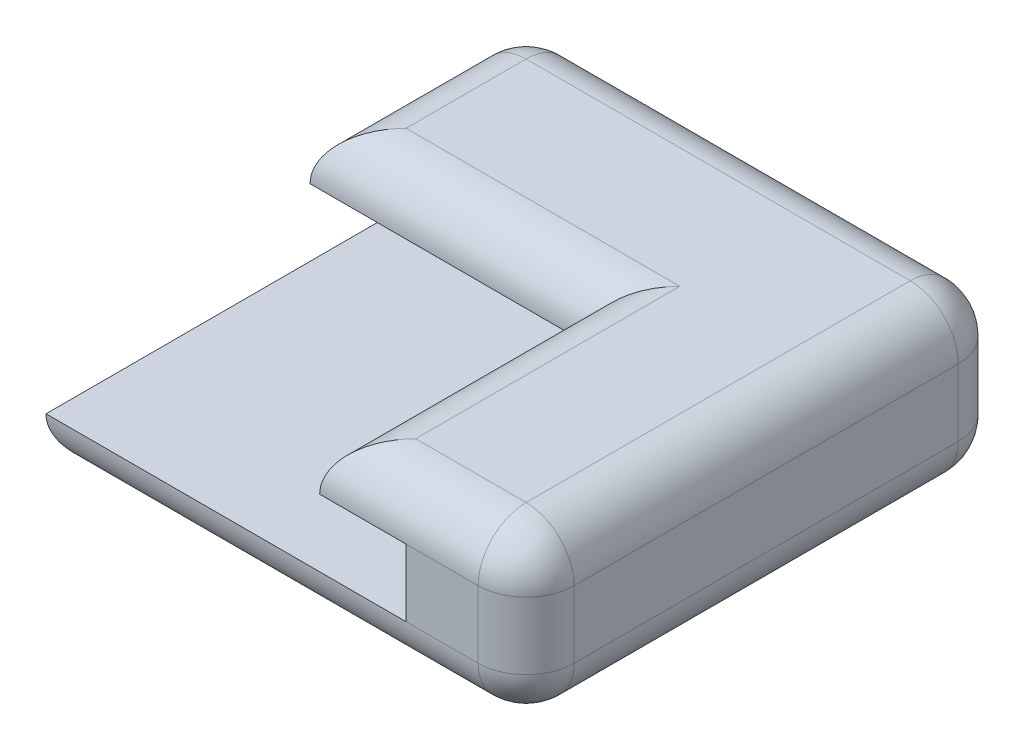
from build123d import *

# Parameters (mm, degrees)
SKETCH1_W                                           = 50
SKETCH1_H                                           = 50
BOSS_EXTRUDE1_DEPTH                                 = 5
SKETCH3_W                                           = 37.499690969
SKETCH3_H                                           = 12.500309031
SKETCH3_W_2                                         = 12.500309031
SKETCH3_H_2                                         = 37.499690969
BOSS_EXTRUDE2_DEPTH                                 = 12
SKETCH5_W                                           = 37.499690969
SKETCH5_H                                           = 5
BOSS_EXTRUDE3_DEPTH                                 = 10
SKETCH6_W                                           = 27.499690969
SKETCH6_H                                           = 5
BOSS_EXTRUDE4_DEPTH                                 = 9
FILLET2_R                                           = 5
CBORE_FOR_3_BINDING_HEAD_MACHINE_SCREW1_D           = 2.794
CBORE_FOR_3_BINDING_HEAD_MACHINE_SCREW1_CBORE_D     = 5.95376
CBORE_FOR_3_BINDING_HEAD_MACHINE_SCREW1_CBORE_DEPTH = 1.4986


with BuildPart() as part:
    # Sketch1 → Boss-Extrude1 (new body)
    with BuildSketch(Plane(origin=(0, 0, 0), x_dir=(1, 0, 0), z_dir=(0, 1, 0))):
        Rectangle(SKETCH1_W, SKETCH1_H)
    extrude(amount=BOSS_EXTRUDE1_DEPTH)

    # Sketch3 → Boss-Extrude2 (add)
    with BuildSketch(Plane(origin=(0, 5, 0), x_dir=(1, 0, 0), z_dir=(0, 1, 0))):
        with Locations((-6.250154515, 18.749845484)):
            Rectangle(SKETCH3_W, SKETCH3_H)
        with Locations((18.749845484, 18.749845484)):
            Rectangle(SKETCH3_W_2, SKETCH3_H)
        with Locations((18.749845484, -6.250154515)):
            Rectangle(SKETCH3_W_2, SKETCH3_H_2)
    extrude(amount=BOSS_EXTRUDE2_DEPTH)

    # Sketch5 → Boss-Extrude3 (add)
    with BuildSketch(Plane.XY.offset(-12.499690969)):
        with Locations((-6.250154515, 14.5)):
            Rectangle(SKETCH5_W, SKETCH5_H)
    extrude(amount=BOSS_EXTRUDE3_DEPTH)

    # Sketch6 → Boss-Extrude4 (add)
    with BuildSketch(Plane.ZY.offset(-12.499690969)):
        with Locations((11.250154516, 14.5)):
            Rectangle(SKETCH6_W, SKETCH6_H)
    extrude(amount=BOSS_EXTRUDE4_DEPTH)

    # Fillet2
    fillet2_edges = [part.edges().sort_by_distance(p)[0] for p in [
        (0, 0, 25),
        (-25, 0, 0),
        (0, 0, -25),
        (25, 8.5, -25),
        (-25, 8.5, -25),
        (25, 17, 0),
        (0, 17, -25),
        (-25, 17, -13.749845484),
        (3.499690969, 17, 11.250154516),
        (-10.750154516, 17, -2.499690969),
        (14.249845484, 17, 25),
        (25, 8.5, 25),
        (25, 0, 0),
    ]]
    fillet(fillet2_edges, radius=FILLET2_R - 0.0001)  # a hair under: the kernel refuses the full size

    # CBORE for #3 Binding Head Machine Screw1 (through all)
    with Locations(Plane(origin=(0, 0, 0), x_dir=(-1, 0, 0), z_dir=(0, -1, 0))):
        with Locations((0, 0)):
            CounterBoreHole(CBORE_FOR_3_BINDING_HEAD_MACHINE_SCREW1_D / 2, CBORE_FOR_3_BINDING_HEAD_MACHINE_SCREW1_CBORE_D / 2, CBORE_FOR_3_BINDING_HEAD_MACHINE_SCREW1_CBORE_DEPTH)


solid = part.part
